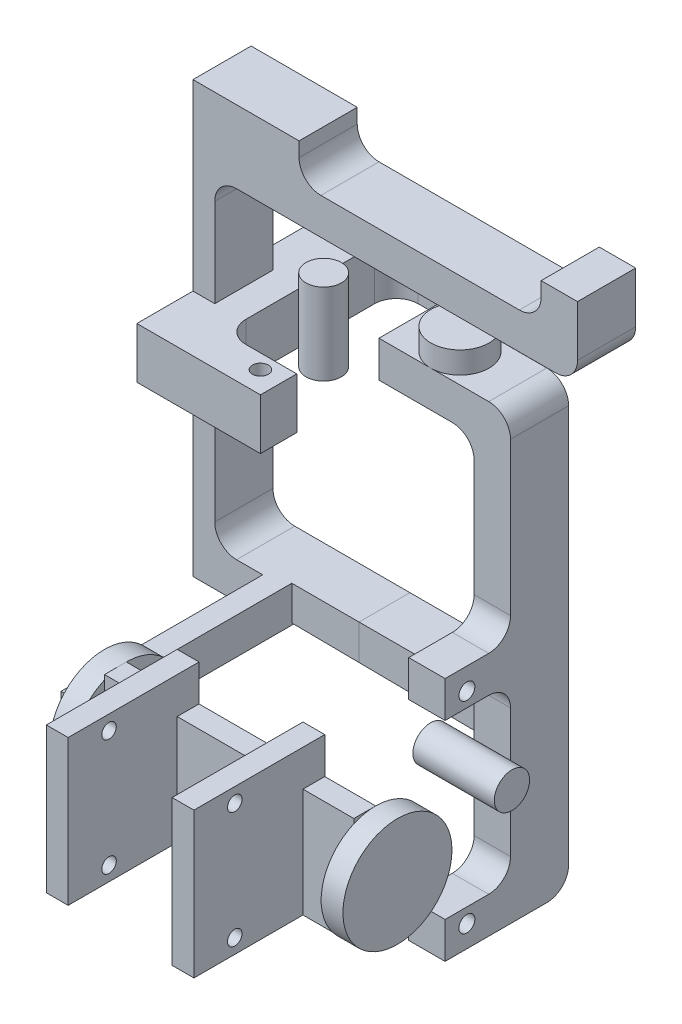
from build123d import *

# Parameters (mm, degrees)
SKETCH_1_W                 = 14.3
SKETCH_1_H                 = 15
EXTRUDE_1_DEPTH            = 3
SKETCH_1_W_2               = 7
EXTRUDE_1_2_DEPTH          = 3
EXTRUDE_1_3_DEPTH          = 3
SKETCH_1_5_W               = 3
SKETCH_1_5_H               = 20
EXTRUDE_2_DEPTH            = 18
CUT_EXTRUDE_1_DEPTH        = 39.331318788
CUT_EXTRUDE_1_DEPTH_BACK   = 39.331318788
SKETCH_2_R                 = 1
SKETCH_4_R                 = 2.43
EXTRUDE_7_DEPTH            = 11.2
SKETCH_8_R                 = 1.1
EXTRUDE_8_DEPTH            = 5
EXTRUDE_9_DEPTH            = 3
EXTRUDE_10_DEPTH           = 3
SKETCH_9_3_W               = 35.766365843
SKETCH_9_3_H               = 5
EXTRUDE_11_DEPTH           = 3
SKETCH_9_4_W               = 3
SKETCH_9_4_H               = 5
EXTRUDE_12_DEPTH           = 26.1
EXTRUDE_13_DEPTH           = 8
SKETCH_11_R                = 4
EXTRUDE_14_DEPTH           = 3
EXTRUDE_15_DEPTH           = 5
SKETCH_12_3_W              = 5
SKETCH_12_3_H              = 8
EXTRUDE_16_DEPTH           = 10
SKETCH_11_3_R              = 2.43
EXTRUDE_17_DEPTH           = 11.2
EXTRUDE_18_DEPTH           = 3
EXTRUDE_18_DEPTH_BACK      = 4
SKETCH_13_R                = 1.1
EXTRUDE_START              = -34
EXTRUDE_20_DEPTH           = 59.2
SKETCH_15_W                = 8
SKETCH_15_H                = 5
EXTRUDE_21_DEPTH           = 6.6
EXTRUDE_22_DEPTH           = 4
SKETCH_17_W                = 23.7
SKETCH_17_H                = 7
EXTRUDE_23_DEPTH           = 4
FILLET_3_R                 = 3
FILLET_4_R                 = 3
SPLIT_START                = 13.1
SPLIT_BODIES_1_OUTLINE_R   = 1.1
SPLIT_BODIES_1_DEPTH       = 5
SPLIT_BODIES_1_2_OUTLINE_W = 5
SPLIT_BODIES_1_2_OUTLINE_H = 8
SPLIT_BODIES_1_2_DEPTH     = 15.1
SPLIT_START_2              = -3.75023667
SPLIT_BODIES_1_3_OUTLINE_W = 5
SPLIT_BODIES_1_3_OUTLINE_H = 0.016365843
SPLIT_BODIES_1_3_DEPTH     = 16.85023667
SPLIT_START_3              = -32.75
SPLIT_BODIES_1_4_DEPTH     = 6.983634157
SPLIT_START_4              = -25.766365843
SPLIT_BODIES_1_5_DEPTH     = 1.016365843
SPLIT_BODIES_1_6_DEPTH     = 2.983634157
SPLIT_START_5              = 46.2
SPLIT_BODIES_1_7_OUTLINE_R = 4
SPLIT_BODIES_1_7_DEPTH     = 3
SPLIT_BODIES_1_8_OUTLINE_R = 1.1
SPLIT_BODIES_1_8_DEPTH     = 21.85023667
SKETCH_19_W                = 2
SKETCH_19_H                = 2
EXTRUDE_24_DEPTH           = 4
SKETCH_19_3_W              = 2.2
SKETCH_19_3_H              = 2.2
CUT_EXTRUDE_2_DEPTH        = 4


with BuildPart() as part:
    # 草图1 → 凸台-拉伸1 (new body)
    with BuildSketch(Plane.XY):
        with Locations((7.15, 7.5)):
            Rectangle(SKETCH_1_W, SKETCH_1_H)
    extrude(amount=EXTRUDE_1_DEPTH)



with BuildPart() as body_2:
    # 草图1 → Extrude 1 2 (new body)
    with BuildSketch(Plane.XY):
        with Locations((-6.5, 7.5)):
            Rectangle(SKETCH_1_W_2, SKETCH_1_H)
    extrude(amount=EXTRUDE_1_2_DEPTH)


with BuildPart() as body_3:
    # 草图1 → Extrude 1 3 (new body)
    with BuildSketch(Plane.XY):
        with Locations((20.8, 7.5)):
            Rectangle(SKETCH_1_W_2, SKETCH_1_H)
    extrude(amount=EXTRUDE_1_3_DEPTH)


with BuildPart() as part_1:
    add(part.part)

    add(body_2.part)  # 凸台-拉伸2 merges body 2

    add(body_3.part)  # 凸台-拉伸2 merges body 3
    # 草图1<5> → 凸台-拉伸2 (add)
    with BuildSketch(Plane.XY):
        with Locations((-1.5, 10)):
            Rectangle(SKETCH_1_5_W, SKETCH_1_5_H)
        with Locations((15.8, 10)):
            Rectangle(SKETCH_1_5_W, SKETCH_1_5_H)
    extrude(amount=EXTRUDE_2_DEPTH)

    # 草图2 → 切除-拉伸1 (cut, two sides: drawn at the far end of the back side and taken through both)
    with BuildSketch(Plane(origin=(17.3, 0, 0), x_dir=(0, 0, -1), z_dir=(1, 0, 0)).offset(-CUT_EXTRUDE_1_DEPTH_BACK)):
        with Locations(Location((-12.38, 18, 0), (0, 0, 90))):
            Circle(SKETCH_2_R)
        with Locations(Location((-12.38, 2, 0), (0, 0, 90))):
            Circle(SKETCH_2_R)
    extrude(amount=CUT_EXTRUDE_1_DEPTH + CUT_EXTRUDE_1_DEPTH_BACK, mode=Mode.SUBTRACT)

    # 草图4<4> → 凸台-拉伸9 (add)
    with BuildSketch(Plane(origin=(24.3, 0, 0), x_dir=(0, 0, -1), z_dir=(1, 0, 0))):
        with BuildLine():
            ThreePointArc((0, 0), (5.303300859, 2.196699141), (7.5, 7.5))
            ThreePointArc((7.5, 7.5), (5.303300859, 12.803300859), (0, 15))
            Line((0, 15), (0, 0))
        make_face()
        with BuildLine():
            Line((0, 0), (0, 15))
            ThreePointArc((0, 15), (-1.532322328, 14.841797347), (-3, 14.373863542))
            Line((-3, 14.373863542), (-3, 0.626136458))
            ThreePointArc((-3, 0.626136458), (-1.532322328, 0.158202653), (0, 0))
        make_face()
        with BuildLine():
            Line((-3, 0.626136458), (-3, 14.373863542))
            ThreePointArc((-3, 14.373863542), (-7.5, 7.5), (-3, 0.626136458))
        make_face()
    extrude(amount=EXTRUDE_9_DEPTH)


with BuildPart() as body_2_2:
    # 草图4 → 凸台-拉伸7 (new body)
    with BuildSketch(Plane(origin=(24.3, 0, 0), x_dir=(0, 0, -1), z_dir=(1, 0, 0))):
        with Locations((18.75, 7.5)):
            Circle(SKETCH_4_R)
    extrude(amount=-EXTRUDE_7_DEPTH)


with BuildPart() as body_3_2:
    # 草图8 → 凸台-拉伸8 (new body)
    with BuildSketch(Plane.ZY.offset(-13.1)):
        Polygon((-24.75, 19.2), (-24.75, 46.2), (-32.75, 46.2), (-32.75, -14.5), (-15.75, -14.5), (-15.75, -11.5), (-15.75, -9.5), (-24.75, -9.5), (-24.75, 14.2), (-15.75, 14.2), (-15.75, 19.2), align=None)
        with Locations((-18.75, 16.2)):
            Circle(SKETCH_8_R, mode=Mode.SUBTRACT)
        with Locations((-18.75, -11.5)):
            Circle(SKETCH_8_R, mode=Mode.SUBTRACT)
    extrude(amount=-EXTRUDE_8_DEPTH)



with BuildPart() as body_4:
    # 草图9 → 凸台-拉伸10 (new body)
    with BuildSketch(Plane.ZY.offset(13)):
        with BuildLine():
            ThreePointArc((7.5, 7.5), (1.26826484, 14.891989197), (-7.071067812, 10))
            Line((-7.071067812, 10), (0, 10))
            Line((0, 10), (3, 10))
            Line((3, 10), (3, 5))
            Line((3, 5), (-7.071067812, 5))
            ThreePointArc((-7.071067812, 5), (1.26826484, 0.108010803), (7.5, 7.5))
        make_face()
        with BuildLine():
            Line((0, 10), (-7.071067812, 10))
            ThreePointArc((-7.071067812, 10), (-7.5, 7.5), (-7.071067812, 5))
            Line((-7.071067812, 5), (3, 5))
            Line((3, 5), (3, 10))
            Line((3, 10), (0, 10))
        make_face()
    extrude(amount=-EXTRUDE_10_DEPTH)


with BuildPart() as body_5:
    # 草图9<3> → 凸台-拉伸11 (new body)
    with BuildSketch(Plane.ZY.offset(13)):
        with Locations((-14.883182922, 7.5)):
            Rectangle(SKETCH_9_3_W, SKETCH_9_3_H)
    extrude(amount=EXTRUDE_11_DEPTH)


with BuildPart() as body_3_2_1:
    add(body_3_2.part)

    add(body_5.part)  # 凸台-拉伸12 merges body 5
    # 草图9<4> → 凸台-拉伸12 (add)
    with BuildSketch(Plane.ZY.offset(13)):
        with Locations((-31.266365843, 7.5)):
            Rectangle(SKETCH_9_4_W, SKETCH_9_4_H)
    extrude(amount=-EXTRUDE_12_DEPTH)

    # 草图10 → 凸台-拉伸13 (add)
    with BuildSketch(Plane.XY.offset(-24.75)):
        Polygon((13.1, 41.2), (13.1, 46.2), (0, 46.2), (0, 41.2), (7.15, 41.2), align=None)
    extrude(amount=-EXTRUDE_13_DEPTH)

    # 草图11 → 凸台-拉伸14 (add)
    with BuildSketch(Plane(origin=(0, 46.2, 0), x_dir=(1, 0, 0), z_dir=(0, 1, 0))):
        with Locations(Location((7.15, 28.75, 0), (0, 0, 270))):
            Circle(SKETCH_11_R)
    extrude(amount=EXTRUDE_14_DEPTH)



with BuildPart() as body_5_2:
    # 草图12 → 凸台-拉伸15 (new body)
    with BuildSketch(Plane(origin=(0, 54.2, 0), x_dir=(1, 0, 0), z_dir=(0, 1, 0))):
        Polygon((-6, 32.766365843), (-11, 32.766365843), (-11, 24.766365843), (22.3, 24.766365843), (22.3, 32.766365843), align=None)
    extrude(amount=EXTRUDE_15_DEPTH)

    # 草图12<3> → 凸台-拉伸16 (add)
    with BuildSketch(Plane(origin=(0, 54.2, 0), x_dir=(1, 0, 0), z_dir=(0, 1, 0))):
        with Locations((-13.5, 28.766365843)):
            Rectangle(SKETCH_12_3_W, SKETCH_12_3_H)
        with Locations((24.8, 28.766365843)):
            Rectangle(SKETCH_12_3_W, SKETCH_12_3_H)
    extrude(amount=EXTRUDE_16_DEPTH)


with BuildPart() as body_6:
    # 草图11<3> → 凸台-拉伸17 (new body)
    with BuildSketch(Plane(origin=(0, 46.2, 0), x_dir=(1, 0, 0), z_dir=(0, 1, 0))):
        with Locations(Location((-11.6, 28.75, 0), (0, 0, 270))):
            Circle(SKETCH_11_3_R)
    extrude(amount=-EXTRUDE_17_DEPTH)


with BuildPart() as body_7:
    # 草图13 → 凸台-拉伸18 (new, two sides: drawn at the far end of the back side and taken through both)
    # profile 1 of 3: a face of its own
    with BuildSketch(Plane.XZ.offset(-35).offset(-EXTRUDE_18_DEPTH_BACK)):
        Polygon((-8.6, -22.05), (-8.6, -20.05), (-8.6, -17.05), (-14.6, -17.05), (-22.6, -17.05), (-22.6, -22.05), (-14.6, -22.05), align=None)
        with Locations(Location((-11.6, -20.05, 0), (0, 0, 270))):
            Circle(SKETCH_13_R, mode=Mode.SUBTRACT)
    # profile 2 of 3: a face of its own
    with BuildSketch(Plane.XZ.offset(-35).offset(-EXTRUDE_18_DEPTH_BACK)):
        Polygon((-22.6, -45.75), (-22.6, -22.05), (-22.6, -17.05), (-25.6, -17.05), (-25.6, -45.75), (-25.6, -50.75), (-22.6, -50.75), align=None)
    # profile 3 of 3: a face of its own
    with BuildSketch(Plane.XZ.offset(-35).offset(-EXTRUDE_18_DEPTH_BACK)):
        Polygon((-14.6, -45.75), (-22.6, -45.75), (-22.6, -50.75), (-14.6, -50.75), (-8.6, -50.75), (-8.6, -47.75), (-8.6, -45.75), align=None)
        with Locations(Location((-11.6, -47.75, 0), (0, 0, 270))):
            Circle(SKETCH_13_R, mode=Mode.SUBTRACT)
    extrude(amount=EXTRUDE_18_DEPTH + EXTRUDE_18_DEPTH_BACK)

    # 草图14 → 凸台-拉伸20 (add)
    with BuildSketch(Plane(origin=(0, 39, 0), x_dir=(1, 0, 0), z_dir=(0, 1, 0)).offset(EXTRUDE_START)):
        Polygon((-22.6, 32.766365843), (-25.6, 32.766365843), (-25.6, 25.29220792), (-25.6, 24.766365843), (-22.6, 24.766365843), align=None)
    extrude(amount=EXTRUDE_20_DEPTH)


with BuildPart() as body_3_2_2:
    add(body_3_2_1.part)

    add(body_5_2.part)  # 凸台-拉伸21 merges body 5 2

    add(body_7.part)  # 凸台-拉伸21 merges body 7
    # 草图15 → 凸台-拉伸21 (add)
    with BuildSketch(Plane(origin=(-22.6, 0, 0), x_dir=(0, 0, -1), z_dir=(1, 0, 0))):
        with Locations((28.766365843, 7.5)):
            Rectangle(SKETCH_15_W, SKETCH_15_H)
        Polygon((24.766365843, 54.2), (32.709950035, 54.2), (32.766365843, 64.2), (24.766365843, 64.2), align=None)
    extrude(amount=EXTRUDE_21_DEPTH)

    # 草图16 → 凸台-拉伸22 (add)
    with BuildSketch(Plane.XY.offset(-29.766365843)):
        Polygon((-13, 10), (-13, 5.265997038), (13.1, 5), (13.1, 10), align=None)
    extrude(amount=EXTRUDE_22_DEPTH)

    # 草图17 → 凸台-拉伸23 (add)
    with BuildSketch(Plane(origin=(-22.6, 0, 0), x_dir=(0, 0, -1), z_dir=(1, 0, 0))):
        with Locations((33.9, 35.5)):
            Rectangle(SKETCH_17_W, SKETCH_17_H)
    extrude(amount=EXTRUDE_23_DEPTH)

    # 圆角3
    fillet_3_edges = [body_3_2_2.edges().sort_by_distance(p)[0] for p in [
        (-18.6, 35.5, -22.05),
        (-18.6, 35.5, -45.75),
        (-11, 59.2, -28.766365843),
        (-22.6, 54.2, -28.738157939),
        (22.3, 59.2, -28.766365843),
        (-22.6, 10, -28.766365843),
        (13.1, 10, -29.258182921),
        (15.6, 14.2, -24.75),
        (15.6, -9.5, -24.75),
        (15.6, 19.2, -24.75),
        (13.1, 41.2, -28.75),
    ]]
    fillet(fillet_3_edges, radius=FILLET_3_R)

    # 圆角4
    fillet_4_edges = [body_3_2_2.edges().sort_by_distance(p)[0] for p in [
        (27.3, 54.2, -28.766365843),
        (18.1, 46.2, -28.75),
        (15.6, -14.5, -32.75),
    ]]
    fillet(fillet_4_edges, radius=FILLET_4_R)

    # Split Bodies 1 8 outline → Split Bodies 1 8 (cut)
    with BuildSketch(Plane.YZ.offset(SPLIT_START_2)):
        with BuildLine():
            ThreePointArc((-14.5, -29.75), (-13.621320344, -31.871320344), (-11.5, -32.75))
            Line((-11.5, -32.75), (5, -32.75))
            Line((5, -32.75), (5, -32.766365843))
            Line((5, -32.766365843), (10, -32.766365843))
            Line((10, -32.766365843), (10, -32.75))
            Line((10, -32.75), (41.2, -32.75))
            Line((41.2, -32.75), (41.2, -32.766365843))
            Line((41.2, -32.766365843), (49.2, -32.766365843))
            Line((49.2, -32.766365843), (49.2, -14))
            Line((49.2, -14), (41.2, -14))
            Line((41.2, -14), (41.2, -24.75))
            Line((41.2, -24.75), (22.2, -24.75))
            ThreePointArc((22.2, -24.75), (20.078679656, -23.871320344), (19.2, -21.75))
            Line((19.2, -21.75), (19.2, -15.75))
            Line((19.2, -15.75), (14.2, -15.75))
            Line((14.2, -15.75), (14.2, -21.75))
            ThreePointArc((14.2, -21.75), (13.321320344, -23.871320344), (11.2, -24.75))
            Line((11.2, -24.75), (-6.5, -24.75))
            ThreePointArc((-6.5, -24.75), (-8.621320344, -23.871320344), (-9.5, -21.75))
            Line((-9.5, -21.75), (-9.5, -15.75))
            Line((-9.5, -15.75), (-14.5, -15.75))
            Line((-14.5, -15.75), (-14.5, -29.75))
        make_face()
        with Locations((-11.5, -18.75)):
            Circle(SPLIT_BODIES_1_8_OUTLINE_R, mode=Mode.SUBTRACT)
        with Locations((16.2, -18.75)):
            Circle(SPLIT_BODIES_1_8_OUTLINE_R, mode=Mode.SUBTRACT)
    extrude(amount=SPLIT_BODIES_1_8_DEPTH, mode=Mode.SUBTRACT)

    # 草图19 → 凸台-拉伸24 (add)
    with BuildSketch(Plane(origin=(-3.75023667, 0, 0), x_dir=(0, 0, -1), z_dir=(1, 0, 0))):
        with Locations((28.766365843, 7.5)):
            Rectangle(SKETCH_19_W, SKETCH_19_H)
    extrude(amount=EXTRUDE_24_DEPTH)


with BuildPart() as body_6_2:
    # Split Bodies 1: read off the stored shape, not the designer's step
    # Split Bodies 1 outline → Split Bodies 1 (new body)
    with BuildSketch(Plane.YZ.offset(SPLIT_START)):
        with BuildLine():
            Line((10, -32.75), (41.2, -32.75))
            Line((41.2, -32.75), (41.2, -24.75))
            Line((41.2, -24.75), (22.2, -24.75))
            ThreePointArc((22.2, -24.75), (20.078679656, -23.871320344), (19.2, -21.75))
            Line((19.2, -21.75), (19.2, -15.75))
            Line((19.2, -15.75), (14.2, -15.75))
            Line((14.2, -15.75), (14.2, -21.75))
            ThreePointArc((14.2, -21.75), (13.321320344, -23.871320344), (11.2, -24.75))
            Line((11.2, -24.75), (-6.5, -24.75))
            ThreePointArc((-6.5, -24.75), (-8.621320344, -23.871320344), (-9.5, -21.75))
            Line((-9.5, -21.75), (-9.5, -15.75))
            Line((-9.5, -15.75), (-14.5, -15.75))
            Line((-14.5, -15.75), (-14.5, -29.75))
            ThreePointArc((-14.5, -29.75), (-13.621320344, -31.871320344), (-11.5, -32.75))
            Line((-11.5, -32.75), (5, -32.75))
            Line((5, -32.75), (10, -32.75))
        make_face()
        with Locations((-11.5, -18.75)):
            Circle(SPLIT_BODIES_1_OUTLINE_R, mode=Mode.SUBTRACT)
        with Locations((16.2, -18.75)):
            Circle(SPLIT_BODIES_1_OUTLINE_R, mode=Mode.SUBTRACT)
    extrude(amount=SPLIT_BODIES_1_DEPTH)

    # Split Bodies 1 2 outline → Split Bodies 1 2 (add)
    with BuildSketch(Plane.YZ):
        with Locations((43.7, -28.75)):
            Rectangle(SPLIT_BODIES_1_2_OUTLINE_W, SPLIT_BODIES_1_2_OUTLINE_H)
    extrude(amount=SPLIT_BODIES_1_2_DEPTH)

    # Split Bodies 1 3 outline → Split Bodies 1 3 (add)
    with BuildSketch(Plane.YZ.offset(SPLIT_START_2)):
        with Locations((7.5, -32.758182922)):
            Rectangle(SPLIT_BODIES_1_3_OUTLINE_W, SPLIT_BODIES_1_3_OUTLINE_H)
    extrude(amount=SPLIT_BODIES_1_3_DEPTH)

    # Split Bodies 1 4 outline → Split Bodies 1 4 (add)
    with BuildSketch(Plane.XY.offset(SPLIT_START_3)):
        with BuildLine():
            Line((10.1, 10), (-3.75023667, 10))
            Line((-3.75023667, 10), (-3.75023667, 5.171728469))
            Line((-3.75023667, 5.171728469), (13.1, 5))
            Line((13.1, 5), (13.1, 13))
            ThreePointArc((13.1, 13), (12.221320344, 10.878679656), (10.1, 10))
        make_face()
        with BuildLine():
            ThreePointArc((10.1, 41.2), (12.221320344, 40.321320344), (13.1, 38.2))
            Line((13.1, 38.2), (13.1, 41.2))
            Line((13.1, 41.2), (10.1, 41.2))
        make_face()
        with BuildLine():
            Line((18.1, 41.2), (18.1, 43.2))
            ThreePointArc((18.1, 43.2), (17.221320344, 45.321320344), (15.1, 46.2))
            Line((15.1, 46.2), (15.1, 41.2))
            Line((15.1, 41.2), (18.1, 41.2))
        make_face()
    extrude(amount=SPLIT_BODIES_1_4_DEPTH)

    # Split Bodies 1 5 outline → Split Bodies 1 5 (add)
    with BuildSketch(Plane.XY.offset(SPLIT_START_4)):
        with BuildLine():
            ThreePointArc((10.1, 41.2), (12.221320344, 40.321320344), (13.1, 38.2))
            Line((13.1, 38.2), (13.1, 41.2))
            Line((13.1, 41.2), (10.1, 41.2))
        make_face()
        with BuildLine():
            Line((18.1, 41.2), (18.1, 43.2))
            ThreePointArc((18.1, 43.2), (17.221320344, 45.321320344), (15.1, 46.2))
            Line((15.1, 46.2), (15.1, 41.2))
            Line((15.1, 41.2), (18.1, 41.2))
        make_face()
    extrude(amount=SPLIT_BODIES_1_5_DEPTH)

    # Split Bodies 1 6 outline → Split Bodies 1 6 (add)
    with BuildSketch(Plane.XY.offset(SPLIT_START_3)):
        Polygon((13.1, 5), (-3.75023667, 5.171728469), (-3.75023667, 5), align=None)
    extrude(amount=SPLIT_BODIES_1_6_DEPTH)

    # Split Bodies 1 7 outline → Split Bodies 1 7 (add)
    with BuildSketch(Plane(origin=(0, 0, 0), x_dir=(1, 0, 0), z_dir=(0, 1, 0)).offset(SPLIT_START_5)):
        with Locations((7.15, 28.75)):
            Circle(SPLIT_BODIES_1_7_OUTLINE_R)
    extrude(amount=SPLIT_BODIES_1_7_DEPTH)

    # 草图19<3> → 切除-拉伸2 (cut)
    with BuildSketch(Plane(origin=(-3.75023667, 0, 0), x_dir=(0, 0, -1), z_dir=(1, 0, 0))):
        with Locations((28.766365843, 7.5)):
            Rectangle(SKETCH_19_3_W, SKETCH_19_3_H)
    extrude(amount=CUT_EXTRUDE_2_DEPTH, mode=Mode.SUBTRACT)


solid = Compound([part_1.part, body_2_2.part, body_4.part, body_6.part, body_3_2_2.part, body_6_2.part])
